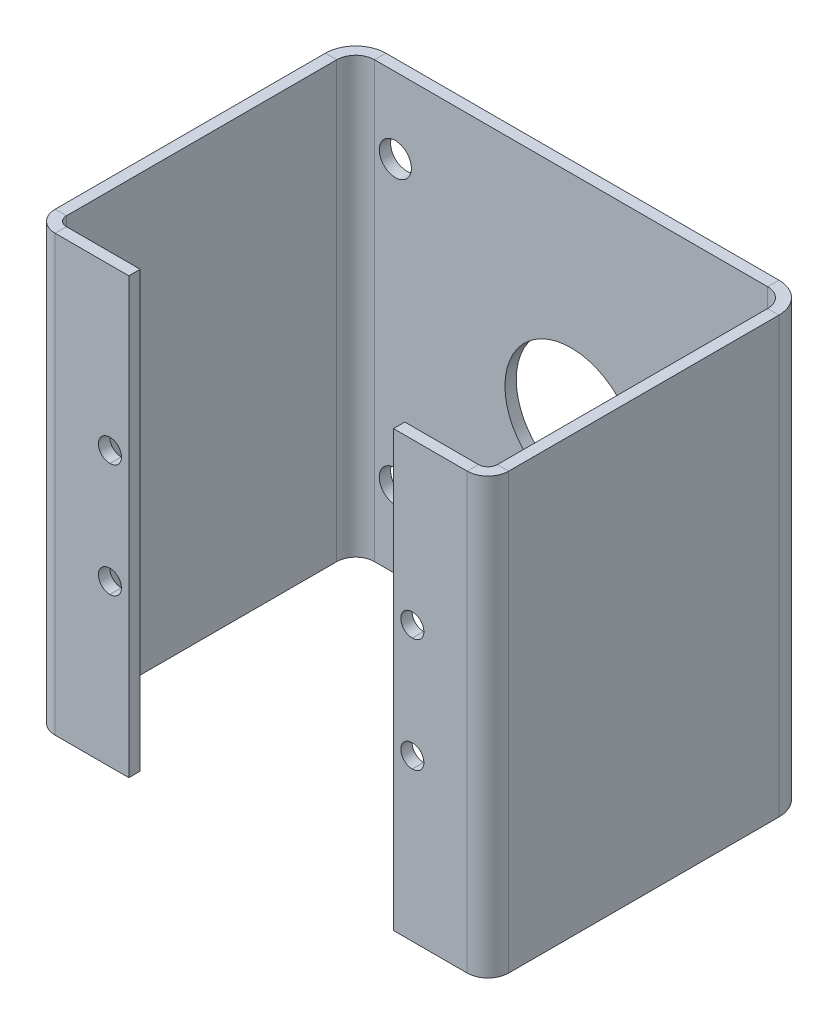
from build123d import *

# Parameters (mm, degrees)
SKETCH1_W                      = 120
SKETCH1_H                      = 115
BASE_FLANGE1_DEPTH             = 3
EDGE_FLANGE1_STRIP_W           = 22
EDGE_FLANGE1_STRIP_H           = 3
EDGE_FLANGE1_STRIP_CUT_DEPTH   = 115
EDGE_FLANGE1_STRIP_2_W         = 22
EDGE_FLANGE1_STRIP_2_H         = 3
EDGE_FLANGE1_STRIP_CUT_2_DEPTH = 115
EDGE_FLANGE1_DEPTH             = 115
EDGE_FLANGE1_BEND_DEPTH        = 115
EDGE_FLANGE2_STRIP_W           = 17
EDGE_FLANGE2_STRIP_H           = 3
EDGE_FLANGE2_STRIP_CUT_DEPTH   = 115
EDGE_FLANGE2_STRIP_2_W         = 17
EDGE_FLANGE2_STRIP_2_H         = 3
EDGE_FLANGE2_STRIP_CUT_2_DEPTH = 115
EDGE_FLANGE2_DEPTH             = 115
EDGE_FLANGE2_BEND_DEPTH        = 115
CUT_EXTRUDE1_DEPTH             = 10
LPATTERN1_COUNT                = 2
LPATTERN1_PITCH                = 30
LPATTERN2_COUNT                = 2
LPATTERN2_PITCH                = 80
LPATTERN2_COPY_1_DEPTH         = 10
SKETCH19_R                     = 4.25
CUT_EXTRUDE2_DEPTH             = 10
LPATTERN3_COUNT                = 2
LPATTERN3_PITCH                = 75
SKETCH20_R                     = 17.5
CUT_EXTRUDE3_DEPTH             = 10


# Sheet-metal steps are written as plain solids
with BuildPart() as part:
    # Sketch1 → Base-Flange1 (new body)
    with BuildSketch(Plane.XY):
        Rectangle(SKETCH1_W, SKETCH1_H)
    extrude(amount=-BASE_FLANGE1_DEPTH)

    # Edge-Flange1 strip (across the edge) → Edge-Flange1 strip cut (cut)
    with BuildSketch(Plane(origin=(60, -57.5, 0), x_dir=(-1, 0, 0), z_dir=(0, 1, 0))):
        with Locations((-3, -1.5)):
            Rectangle(EDGE_FLANGE1_STRIP_W, EDGE_FLANGE1_STRIP_H)
    extrude(amount=EDGE_FLANGE1_STRIP_CUT_DEPTH, mode=Mode.SUBTRACT)

    # Edge-Flange1 strip 2 (across the edge) → Edge-Flange1 strip cut 2 (cut)
    with BuildSketch(Plane(origin=(-60, 57.5, 0), x_dir=(1, 0, 0), z_dir=(0, -1, 0))):
        with Locations((-3, -1.5)):
            Rectangle(EDGE_FLANGE1_STRIP_2_W, EDGE_FLANGE1_STRIP_2_H)
    extrude(amount=EDGE_FLANGE1_STRIP_CUT_2_DEPTH, mode=Mode.SUBTRACT)

    # Edge-Flange1 section (across the edge) → Edge-Flange1 (add)
    with BuildSketch(Plane(origin=(60, -57.5, 0), x_dir=(-1, 0, 0), z_dir=(0, 1, 0))):
        with BuildLine():
            Line((0, 5), (0, 82))
            Line((0, 82), (3, 82))
            Line((3, 82), (3, 5))
            ThreePointArc((3, 5), (4.464466094, 1.464466094), (8, 0))
            Line((8, 0), (8, -3))
            ThreePointArc((8, -3), (2.343145751, -0.656854249), (0, 5))
        make_face()
    extrude(amount=EDGE_FLANGE1_DEPTH)

    # Edge-Flange1 section 2 (across the edge) → Edge-Flange1 bend (add)
    with BuildSketch(Plane(origin=(-60, 57.5, 0), x_dir=(1, 0, 0), z_dir=(0, -1, 0))):
        with BuildLine():
            Line((0, 5), (0, 82))
            Line((0, 82), (3, 82))
            Line((3, 82), (3, 5))
            ThreePointArc((3, 5), (4.464466094, 1.464466094), (8, 0))
            Line((8, 0), (8, -3))
            ThreePointArc((8, -3), (2.343145751, -0.656854249), (0, 5))
        make_face()
    extrude(amount=EDGE_FLANGE1_BEND_DEPTH)

    # Edge-Flange2 strip (across the edge) → Edge-Flange2 strip cut (cut)
    with BuildSketch(Plane(origin=(-57, 57.5, 82), x_dir=(0, 0, -1), z_dir=(0, -1, 0))):
        with Locations((-3, -1.5)):
            Rectangle(EDGE_FLANGE2_STRIP_W, EDGE_FLANGE2_STRIP_H)
    extrude(amount=EDGE_FLANGE2_STRIP_CUT_DEPTH, mode=Mode.SUBTRACT)

    # Edge-Flange2 strip 2 (across the edge) → Edge-Flange2 strip cut 2 (cut)
    with BuildSketch(Plane(origin=(57, -57.5, 82), x_dir=(0, 0, -1), z_dir=(0, 1, 0))):
        with Locations((-3, -1.5)):
            Rectangle(EDGE_FLANGE2_STRIP_2_W, EDGE_FLANGE2_STRIP_2_H)
    extrude(amount=EDGE_FLANGE2_STRIP_CUT_2_DEPTH, mode=Mode.SUBTRACT)

    # Edge-Flange2 section (across the edge) → Edge-Flange2 (add)
    with BuildSketch(Plane(origin=(-57, 57.5, 82), x_dir=(0, 0, -1), z_dir=(0, -1, 0))):
        with BuildLine():
            Line((0, 2.5), (0, 22))
            Line((0, 22), (3, 22))
            Line((3, 22), (3, 2.5))
            ThreePointArc((3, 2.5), (3.732233047, 0.732233047), (5.5, 0))
            Line((5.5, 0), (5.5, -3))
            ThreePointArc((5.5, -3), (1.610912703, -1.389087297), (0, 2.5))
        make_face()
    extrude(amount=EDGE_FLANGE2_DEPTH)

    # Edge-Flange2 section 2 (across the edge) → Edge-Flange2 bend (add)
    with BuildSketch(Plane(origin=(57, -57.5, 82), x_dir=(0, 0, -1), z_dir=(0, 1, 0))):
        with BuildLine():
            Line((0, 2.5), (0, 22))
            Line((0, 22), (3, 22))
            Line((3, 22), (3, 2.5))
            ThreePointArc((3, 2.5), (3.732233047, 0.732233047), (5.5, 0))
            Line((5.5, 0), (5.5, -3))
            ThreePointArc((5.5, -3), (1.610912703, -1.389087297), (0, 2.5))
        make_face()
    extrude(amount=EDGE_FLANGE2_BEND_DEPTH)

    # Sketch18 → Cut-Extrude1 (cut)
    with BuildSketch(Plane.XY.offset(82)):
        with BuildLine():
            Line((-40.05, -12), (-39.95, -12))
            ThreePointArc((-39.95, -12), (-36.95, -15), (-39.95, -18))
            Line((-39.95, -18), (-40.05, -18))
            ThreePointArc((-40.05, -18), (-43.05, -15), (-40.05, -12))
        make_face()
    cut_extrude1 = extrude(amount=-CUT_EXTRUDE1_DEPTH, mode=Mode.SUBTRACT)

    # LPattern1: Cut-Extrude1 ×2
    with Locations(*[(0, i * LPATTERN1_PITCH, 0) for i in range(1, LPATTERN1_COUNT)]):
        add(cut_extrude1, mode=Mode.SUBTRACT)

    # LPattern2: Cut-Extrude1 ×2
    with Locations(*[(i * LPATTERN2_PITCH, 0, 0) for i in range(1, LPATTERN2_COUNT)]):
        add(cut_extrude1, mode=Mode.SUBTRACT)

    # LPattern2 copy 1 sketch → LPattern2 copy 1 (cut)
    with BuildSketch(Plane(origin=(80, 30, 82), x_dir=(1, 0, 0), z_dir=(0, 0, 1))):
        with BuildLine():
            Line((-40.05, -12), (-39.95, -12))
            ThreePointArc((-39.95, -12), (-36.95, -15), (-39.95, -18))
            Line((-39.95, -18), (-40.05, -18))
            ThreePointArc((-40.05, -18), (-43.05, -15), (-40.05, -12))
        make_face()
    extrude(amount=-LPATTERN2_COPY_1_DEPTH, mode=Mode.SUBTRACT)

    # Sketch19 → Cut-Extrude2 (cut)
    with BuildSketch(Plane(origin=(0, 0, -3), x_dir=(-1, 0, 0), z_dir=(0, 0, -1))):
        with Locations((-46.5, -37.5)):
            Circle(SKETCH19_R)
        with Locations((46.5, -37.5)):
            Circle(SKETCH19_R)
    cut_extrude2 = extrude(amount=-CUT_EXTRUDE2_DEPTH, mode=Mode.SUBTRACT)

    # LPattern3: Cut-Extrude2 ×2
    with Locations(*[(0, i * LPATTERN3_PITCH, 0) for i in range(1, LPATTERN3_COUNT)]):
        add(cut_extrude2, mode=Mode.SUBTRACT)

    # Sketch20 → Cut-Extrude3 (cut)
    with BuildSketch(Plane(origin=(0, 0, -3), x_dir=(-1, 0, 0), z_dir=(0, 0, -1))):
        Circle(SKETCH20_R)
    extrude(amount=-CUT_EXTRUDE3_DEPTH, mode=Mode.SUBTRACT)


solid = part.part
